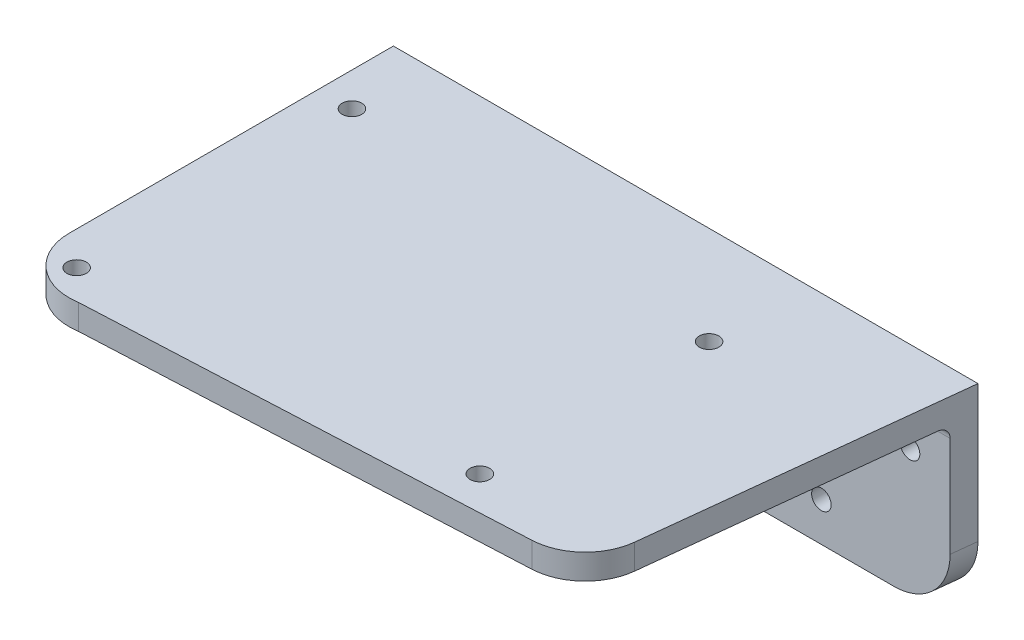
from build123d import *

# Parameters (mm, degrees)
SKETCH2_W           = 132.54933421
SKETCH2_H           = 96.472398488
BOSS_EXTRUDE1_DEPTH = 4.5
CUT_EXTRUDE1_REACH  = 84.093
SKETCH3_R           = 1.75
CUT_EXTRUDE2_REACH  = 84.093
SKETCH4_W           = 132.54933421
SKETCH4_H           = 96.472398488
FILLET1_R           = 10
BOSS_EXTRUDE2_DEPTH = 30
FILLET2_R           = 10
CUT_EXTRUDE3_REACH  = 91.266
SKETCH6_R           = 1.75
RIB1_START          = -2.5
RIB1_DEPTH          = 5
RIB2_START          = -2.5
RIB2_DEPTH          = 5
FILLET3_R           = 2


with BuildPart() as part:
    # Sketch2 → Boss-Extrude1 (new body)
    with BuildSketch(Plane(origin=(0, 0, 0), x_dir=(1, 0, 0), z_dir=(0, 1, 0))):
        Rectangle(SKETCH2_W, SKETCH2_H)
    extrude(amount=BOSS_EXTRUDE1_DEPTH)

    # Sketch3 → Cut-Extrude1 (cut, up to next)
    with BuildSketch(Plane(origin=(0, 4.5, 0), x_dir=(1, 0, 0), z_dir=(0, 1, 0)), mode=Mode.PRIVATE) as cut_extrude1_sk1:
        with Locations(Location((-43.735552551, 28.375291395, 0), (0, 0, 270))):
            Circle(SKETCH3_R)
    cut_extrude1_tool1 = extrude(cut_extrude1_sk1.sketch, amount=-CUT_EXTRUDE1_REACH, mode=Mode.PRIVATE) & part.part
    # Sketch3 → Cut-Extrude1 (cut, up to next)
    with BuildSketch(Plane(origin=(0, 4.5, 0), x_dir=(1, 0, 0), z_dir=(0, 1, 0)), mode=Mode.PRIVATE) as cut_extrude1_sk2:
        with Locations(Location((-43.735552551, -20.948558002, 0), (0, 0, 270))):
            Circle(SKETCH3_R)
    cut_extrude1_tool2 = extrude(cut_extrude1_sk2.sketch, amount=-CUT_EXTRUDE1_REACH, mode=Mode.PRIVATE) & part.part
    # Sketch3 → Cut-Extrude1 (cut, up to next)
    with BuildSketch(Plane(origin=(0, 4.5, 0), x_dir=(1, 0, 0), z_dir=(0, 1, 0)), mode=Mode.PRIVATE) as cut_extrude1_sk3:
        with Locations(Location((24.372618491, -16.816583266, 0), (0, 0, 270))):
            Circle(SKETCH3_R)
    cut_extrude1_tool3 = extrude(cut_extrude1_sk3.sketch, amount=-CUT_EXTRUDE1_REACH, mode=Mode.PRIVATE) & part.part
    # Sketch3 → Cut-Extrude1 (cut, up to next)
    with BuildSketch(Plane(origin=(0, 4.5, 0), x_dir=(1, 0, 0), z_dir=(0, 1, 0)), mode=Mode.PRIVATE) as cut_extrude1_sk4:
        with Locations(Location((24.372618491, 24.243316659, 0), (0, 0, 270))):
            Circle(SKETCH3_R)
    cut_extrude1_tool4 = extrude(cut_extrude1_sk4.sketch, amount=-CUT_EXTRUDE1_REACH, mode=Mode.PRIVATE) & part.part
    add(cut_extrude1_tool1.solids().sort_by_distance((-43.735553, 4.5, -28.375291))[0], mode=Mode.SUBTRACT)
    add(cut_extrude1_tool2.solids().sort_by_distance((-43.735553, 4.5, 20.948558))[0], mode=Mode.SUBTRACT)
    add(cut_extrude1_tool3.solids().sort_by_distance((24.372618, 4.5, 16.816583))[0], mode=Mode.SUBTRACT)
    add(cut_extrude1_tool4.solids().sort_by_distance((24.372618, 4.5, -24.243317))[0], mode=Mode.SUBTRACT)

    # Sketch4 → Cut-Extrude2 (cut, up to next)
    with BuildSketch(Plane(origin=(0, 4.5, 0), x_dir=(1, 0, 0), z_dir=(0, 1, 0)), mode=Mode.PRIVATE) as cut_extrude2_sk1:
        Rectangle(SKETCH4_W, SKETCH4_H)
        with BuildLine():
            Line((-49.755679651, -16.286633303), (-49.755679651, 41.820488279))
            Line((-49.755679651, 41.820488279), (54.978186069, 41.820488279))
            Line((54.978186069, 41.820488279), (47.882417092, -22.041432557))
            Line((47.882417092, -22.041432557), (-38.186956222, -26.162822184))
            ThreePointArc((-38.186956222, -26.162822184), (-46.248474339, -23.892132442), (-49.755679651, -16.286633303))
        make_face(mode=Mode.SUBTRACT)
    cut_extrude2_tool1 = extrude(cut_extrude2_sk1.sketch, amount=-CUT_EXTRUDE2_REACH, mode=Mode.PRIVATE) & part.part
    add(cut_extrude2_tool1.solids().sort_by_distance((-64.635269, 4.5, 0))[0], mode=Mode.SUBTRACT)

    # Fillet1
    fillet1_edges = [part.edges().sort_by_distance(p)[0] for p in [
        (47.882417092, 2.25, 22.041432557),
    ]]
    fillet(fillet1_edges, radius=FILLET1_R)

    # Sketch5 → Boss-Extrude2 (add)
    with BuildSketch(Plane.XZ):
        Polygon((-49.755679651, -37.320488279), (-49.755679651, -41.820488279), (54.978186069, -41.820488279), (54.478186069, -37.320488279), align=None)
    extrude(amount=BOSS_EXTRUDE2_DEPTH)

    # Fillet2
    fillet2_edges = [part.edges().sort_by_distance(p)[0] for p in [
        (-49.755679651, -30, -39.570488279),
        (54.728186069, -30, -39.570488279),
    ]]
    fillet(fillet2_edges, radius=FILLET2_R)

    # Sketch6 → Cut-Extrude3 (cut, up to next)
    with BuildSketch(Plane.XY.offset(-37.320488279), mode=Mode.PRIVATE) as cut_extrude3_sk1:
        with Locations((-42.5984485, -7.071067812)):
            Circle(SKETCH6_R)
    cut_extrude3_tool1 = extrude(cut_extrude3_sk1.sketch, amount=-CUT_EXTRUDE3_REACH, mode=Mode.PRIVATE) & part.part
    # Sketch6 → Cut-Extrude3 (cut, up to next)
    with BuildSketch(Plane.XY.offset(-37.320488279), mode=Mode.PRIVATE) as cut_extrude3_sk2:
        with Locations((-26.740584124, -22.928932188)):
            Circle(SKETCH6_R)
    cut_extrude3_tool2 = extrude(cut_extrude3_sk2.sketch, amount=-CUT_EXTRUDE3_REACH, mode=Mode.PRIVATE) & part.part
    # Sketch6 → Cut-Extrude3 (cut, up to next)
    with BuildSketch(Plane.XY.offset(-37.320488279), mode=Mode.PRIVATE) as cut_extrude3_sk3:
        with Locations(Location((31.415995213, -22.988580525, 0), (0, 0, 180))):
            Circle(SKETCH6_R)
    cut_extrude3_tool3 = extrude(cut_extrude3_sk3.sketch, amount=-CUT_EXTRUDE3_REACH, mode=Mode.PRIVATE) & part.part
    # Sketch6 → Cut-Extrude3 (cut, up to next)
    with BuildSketch(Plane.XY.offset(-37.320488279), mode=Mode.PRIVATE) as cut_extrude3_sk4:
        with Locations(Location((47.306355451, -7.163278737, 0), (0, 0, 180))):
            Circle(SKETCH6_R)
    cut_extrude3_tool4 = extrude(cut_extrude3_sk4.sketch, amount=-CUT_EXTRUDE3_REACH, mode=Mode.PRIVATE) & part.part
    add(cut_extrude3_tool1.solids().sort_by_distance((-42.598449, -7.071068, -37.320488))[0], mode=Mode.SUBTRACT)
    add(cut_extrude3_tool2.solids().sort_by_distance((-26.740584, -22.928932, -37.320488))[0], mode=Mode.SUBTRACT)
    add(cut_extrude3_tool3.solids().sort_by_distance((31.415995, -22.988581, -37.320488))[0], mode=Mode.SUBTRACT)
    add(cut_extrude3_tool4.solids().sort_by_distance((47.306355, -7.163279, -37.320488))[0], mode=Mode.SUBTRACT)

    # Rib1: read off the stored shape, not the designer's step
    # Rib1 outline → Rib1 (add)
    with BuildSketch(Plane(origin=(-10.638742437, 0.010911634, 0), x_dir=(0.001025650165390613, 0.9999994740207309, 0), z_dir=(0.9999994740207307, -0.0010256501653906128, 0)).offset(RIB1_START)):
        with BuildLine():
            Line((-0.008347513, -37.320488279), (-0.008347513, 14.309096835))
            Line((-0.008347513, 14.309096835), (-0.051031921, 14.294776029))
            add(Edge.make_bspline(
                [(-28.165704325, -37.320488279), (-16.507311445, -35.163666341), (-13.858586231, -11.343701008), (-8.750641214, 11.37601897), (-0.051031921, 14.294776029)],
                knots=[0, 0, 0, 0, 0.549950709, 1, 1, 1, 1], degree=3))
            Line((-28.165704325, -37.320488279), (-0.008347513, -37.320488279))
        make_face()
    extrude(amount=RIB1_DEPTH)

    # Rib2: read off the stored shape, not the designer's step
    # Rib2 outline → Rib2 (add)
    with BuildSketch(Plane(origin=(15.361243887, -0.015755271, 0), x_dir=(0.001025650165390613, 0.9999994740207309, 0), z_dir=(0.9999994740207307, -0.0010256501653906128, 0)).offset(RIB2_START)):
        with BuildLine():
            Line((0.018319406, -37.320488279), (0.018319406, 14.318043703))
            Line((0.018319406, 14.318043703), (-0.051031921, 14.294776029))
            add(Edge.make_bspline(
                [(-28.165704325, -37.320488279), (-16.507311445, -35.163666341), (-13.858586231, -11.343701008), (-8.750641214, 11.37601897), (-0.051031921, 14.294776029)],
                knots=[0, 0, 0, 0, 0.549950709, 1, 1, 1, 1], degree=3))
            Line((-28.165704325, -37.320488279), (0.018319406, -37.320488279))
        make_face()
    extrude(amount=RIB2_DEPTH)

    # Fillet3
    fillet3_edges = [part.edges().sort_by_distance(p)[0] for p in [
        (-31.447217297, 0, -37.320488279),
        (2.361253209, 0, -37.320488279),
        (36.169723715, 0, -37.320488279),
    ]]
    fillet(fillet3_edges, radius=FILLET3_R)


solid = part.part
